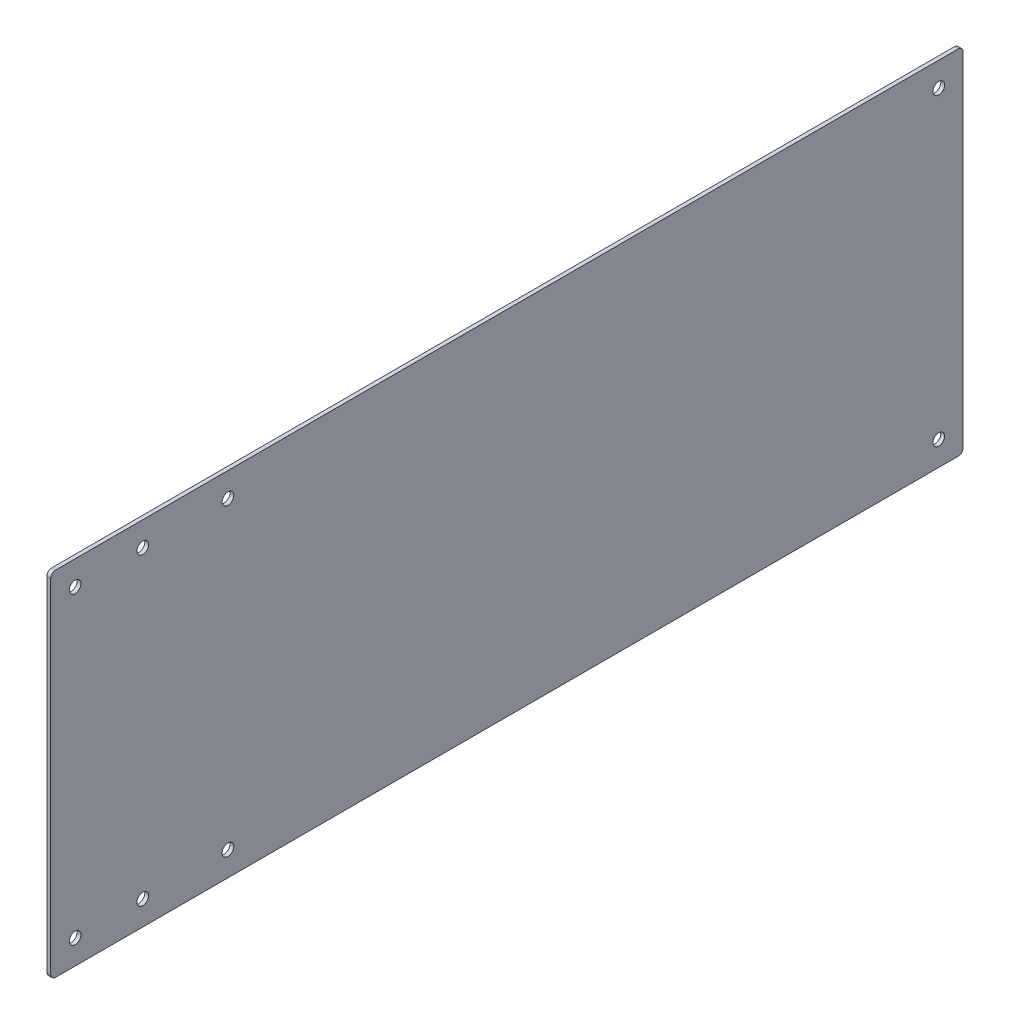
from build123d import *

# Parameters (mm, degrees)
SKETCH1_W            = 375
SKETCH1_H            = 144.98
BASE_FLANGE1_DEPTH   = 1.5875
M4_CLEARANCE_HOLE1_D = 4.8
MIRROR2_COPY_1_D     = 4.8
M4_CLEARANCE_HOLE2_D = 4.8
FILLET1_R            = 2
FILLET2_R            = 2
FILLET3_R            = 2
FILLET4_R            = 2


# Sheet-metal steps are written as plain solids
with BuildPart() as part:
    # Sketch1 → Base-Flange1 (new body)
    with BuildSketch(Plane(origin=(0, 0, 0), x_dir=(0, 0, -1), z_dir=(1, 0, 0))):
        Rectangle(SKETCH1_W, SKETCH1_H)
    extrude(amount=-BASE_FLANGE1_DEPTH)

    # M4 Clearance Hole1 (through all)
    with Locations(Plane.ZY.offset(1.5875)):
        with Locations((177.5, 62.49)):
            m4_clearance_hole1 = Hole(M4_CLEARANCE_HOLE1_D / 2)

    # Mirror1: M4 Clearance Hole1 across plane
    add(m4_clearance_hole1.mirror(Plane.XY), mode=Mode.SUBTRACT)

    # Mirror2: M4 Clearance Hole1 across plane
    add(m4_clearance_hole1.mirror(Plane.ZX), mode=Mode.SUBTRACT)

    # Mirror2 copy 1 (through all)
    with Locations(Plane(origin=(-1.5875, 0, 0), x_dir=(0, 0, -1), z_dir=(-1, 0, 0))):
        with Locations((177.5, 62.49)):
            Hole(MIRROR2_COPY_1_D / 2)

    # M4 Clearance Hole2 (through all)
    with Locations(Plane(origin=(0, 62.49, 149.66), x_dir=(0, 0, 1), z_dir=(1, 0, 0))):
        with Locations((0, 0), (-35, 0)):
            m4_clearance_hole2 = Hole(M4_CLEARANCE_HOLE2_D / 2)

    # Mirror3: M4 Clearance Hole2 across plane
    add(m4_clearance_hole2.mirror(Plane.ZX), mode=Mode.SUBTRACT)

    # Fillet1
    fillet1_edges = [part.edges().sort_by_distance(p)[0] for p in [
        (-0.79375, 72.49, 187.5),
    ]]
    fillet(fillet1_edges, radius=FILLET1_R)

    # Fillet2
    fillet2_edges = [part.edges().sort_by_distance(p)[0] for p in [
        (-0.79375, -72.49, 187.5),
    ]]
    fillet(fillet2_edges, radius=FILLET2_R)

    # Fillet3
    fillet3_edges = [part.edges().sort_by_distance(p)[0] for p in [
        (-0.79375, 72.49, -187.5),
    ]]
    fillet(fillet3_edges, radius=FILLET3_R)

    # Fillet4
    fillet4_edges = [part.edges().sort_by_distance(p)[0] for p in [
        (-0.79375, -72.49, -187.5),
    ]]
    fillet(fillet4_edges, radius=FILLET4_R)


solid = part.part
